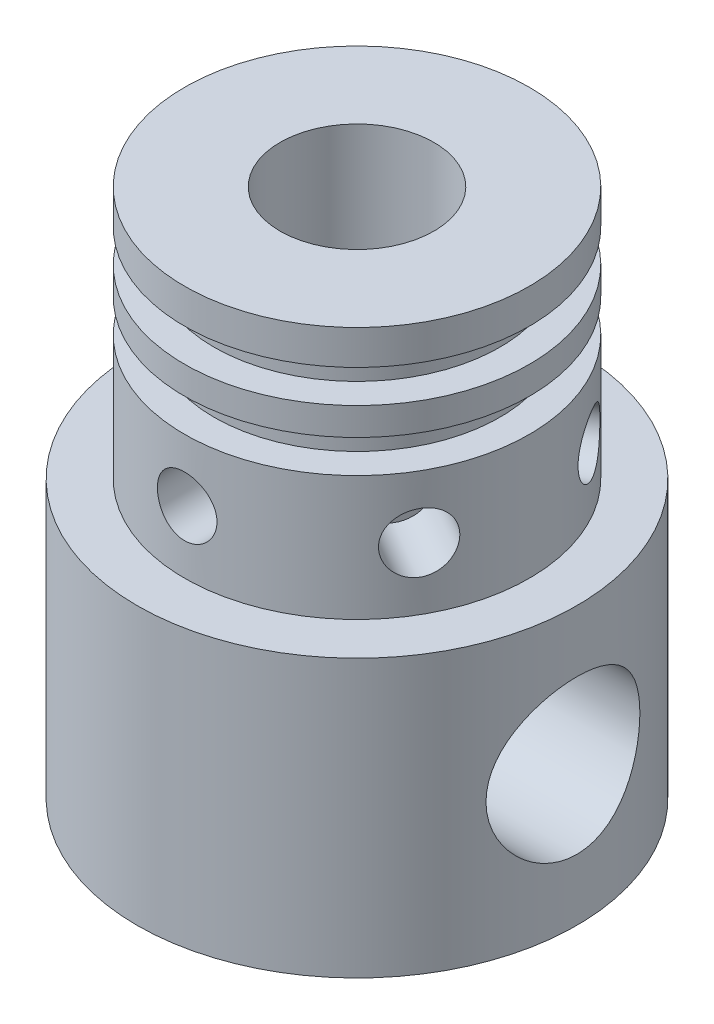
from build123d import *

# Parameters (mm, degrees)
CUT_EXTRUDE1_DEPTH      = 30.496372261
CUT_EXTRUDE1_DEPTH_BACK = 30.496372261
SKETCH2_R               = 5.55625
CUT_EXTRUDE2_REACH      = 46.363
SKETCH3_R               = 5.55625
SKETCH4_R               = 2.15
CUT_EXTRUDE3_DEPTH      = 5
CIRPATTERN1_COUNT       = 6


with BuildPart() as part:
    # Sketch1 → Revolve1 (revolve)
    with BuildSketch(Plane.XY):
        Polygon((0, -19.13125), (15.875, -19.13125), (15.875, 0.86875), (12.45, 0.86875), (12.45, 9.86875), (10.31875, 9.86875), (10.31875, 12.25), (12.45, 12.25), (12.45, 14.25), (10.31875, 14.25), (10.31875, 16.63125), (12.45, 16.63125), (12.45, 19.13125), (0, 19.13125), align=None)
    revolve(axis=Axis((0, -8.095014715, 0), (0, 1, 0)))

    # Sketch2 → Cut-Extrude1 (cut, two sides: drawn at the far end of the back side and taken through both)
    with BuildSketch(Plane(origin=(0, 0, 0), x_dir=(0, 0, -1), z_dir=(1, 0, 0)).offset(-CUT_EXTRUDE1_DEPTH_BACK)):
        with Locations((0, -9.13125)):
            Circle(SKETCH2_R)
    extrude(amount=CUT_EXTRUDE1_DEPTH + CUT_EXTRUDE1_DEPTH_BACK, mode=Mode.SUBTRACT)

    # Sketch3 → Cut-Extrude2 (cut, up to next)
    with BuildSketch(Plane(origin=(0, 19.13125, 0), x_dir=(1, 0, 0), z_dir=(0, 1, 0)), mode=Mode.PRIVATE) as cut_extrude2_sk1:
        Circle(SKETCH3_R)
    cut_extrude2_tool1 = extrude(cut_extrude2_sk1.sketch, amount=-CUT_EXTRUDE2_REACH, mode=Mode.PRIVATE) & part.part
    add(cut_extrude2_tool1.solids().sort_by_distance((0, 19.13125, 0))[0], mode=Mode.SUBTRACT)

    # Sketch4 → Cut-Extrude3 (cut)
    with BuildSketch(Plane.XY.offset(12.45)):
        with Locations((0, 5.36875)):
            Circle(SKETCH4_R)
    cut_extrude3 = extrude(amount=-CUT_EXTRUDE3_DEPTH, mode=Mode.SUBTRACT)

    # CirPattern1: Cut-Extrude3 ×6 about axis
    cirpattern1_axis = Axis((0, -8.095014715, 0), (0, -1, 0))
    for i in range(1, CIRPATTERN1_COUNT):
        add(cut_extrude3.rotate(cirpattern1_axis, i * 360 / CIRPATTERN1_COUNT), mode=Mode.SUBTRACT)


solid = part.part
